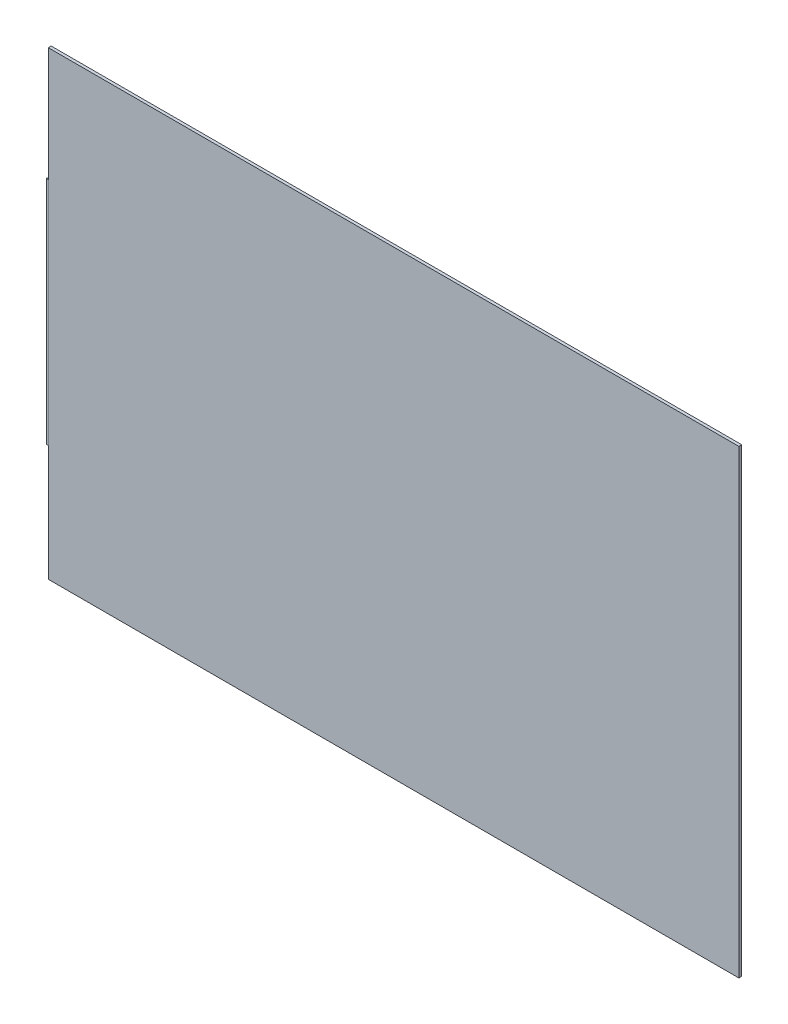
from build123d import *

# Parameters (mm, degrees)
SCHIZZO1_W                   = 1200
SCHIZZO1_H                   = 800
ESTRUSIONE_ESTRUSIONE1_DEPTH = 5
SCHIZZO2_W                   = 2
SCHIZZO2_H                   = 400
ESTRUSIONE_ESTRUSIONE2_DEPTH = 5


with BuildPart() as part:
    # Schizzo1 → Estrusione-Estrusione1 (new body)
    with BuildSketch(Plane.XY):
        Rectangle(SCHIZZO1_W, SCHIZZO1_H)
    extrude(amount=ESTRUSIONE_ESTRUSIONE1_DEPTH)

    # Schizzo2 → Estrusione-Estrusione2 (add)
    with BuildSketch(Plane.ZY.offset(600)):
        with Locations((2.5, 0)):
            Rectangle(SCHIZZO2_W, SCHIZZO2_H)
    extrude(amount=ESTRUSIONE_ESTRUSIONE2_DEPTH)


solid = part.part
